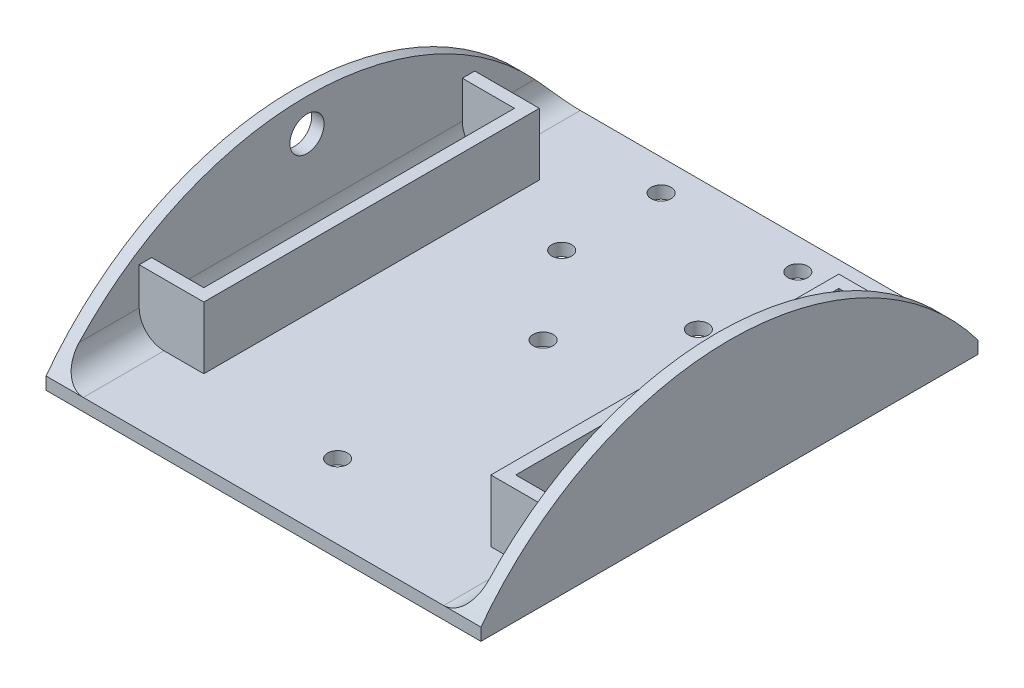
from build123d import *

# Parameters (mm, degrees)
SKETCH1_W           = 88.9
SKETCH1_H           = 101.6
BASE_EXTRUDE_DEPTH  = 2.54
WALL_EXTRUDE_DEPTH  = 2.54
CUT_EXTRUDE1_REACH  = 139.864
SKETCH3_R           = 3.4925
FILLET2_R           = 5.08
SKETCH4_R           = 2.032
CUT_EXTRUDE2_DEPTH  = 138.371503752
SKETCH5_W           = 2.54
SKETCH5_H           = 2.54
SKETCH5_W_2         = 5.08
SKETCH5_W_3         = 3.048
BOSS_EXTRUDE1_DEPTH = 12.7


with BuildPart() as part:
    # Sketch1 → Base Extrude (new body)
    with BuildSketch(Plane(origin=(0, 0, 0), x_dir=(1, 0, 0), z_dir=(0, 1, 0))):
        with Locations((44.45, 50.8)):
            Rectangle(SKETCH1_W, SKETCH1_H)
    extrude(amount=BASE_EXTRUDE_DEPTH)

    # Sketch2 → Wall Extrude (add)
    with BuildSketch(Plane(origin=(88.9, 0, 0), x_dir=(0, 0, -1), z_dir=(1, 0, 0))):
        with BuildLine():
            Line((101.6, 2.54), (101.6, 0))
            Line((101.6, 0), (0, 0))
            Line((0, 0), (0, 2.54))
            ThreePointArc((0, 2.54), (50.8, 27.94), (101.6, 2.54))
        make_face()
    wall_extrude = extrude(amount=-WALL_EXTRUDE_DEPTH)

    # Wall Mirror: Wall Extrude across plane
    add(wall_extrude.mirror(Plane(origin=(44.45, 0, 0), x_dir=(0, 0, 1), z_dir=(1, 0, 0))))

    # Sketch3 → Cut-Extrude1 (cut, up to next)
    with BuildSketch(Plane.ZY, mode=Mode.PRIVATE) as cut_extrude1_sk1:
        with Locations((-50.8, 21.2725)):
            Circle(SKETCH3_R)
    cut_extrude1_tool1 = extrude(cut_extrude1_sk1.sketch, amount=-CUT_EXTRUDE1_REACH, mode=Mode.PRIVATE) & part.part
    add(cut_extrude1_tool1.solids().sort_by_distance((0, 21.2725, -50.8))[0], mode=Mode.SUBTRACT)

    # Fillet2
    # the kernel refuses this fillet: 5.08 mm, written as the material it adds along each edge
    with BuildSketch(Plane(origin=(86.36, 2.54, -101.6), x_dir=(-1, 0, 0), z_dir=(0, 0, 1))) as fillet2_piece_1_section:
        with BuildLine():
            CenterArc((FILLET2_R, -FILLET2_R), FILLET2_R, 90, 90)
            Line((0, -FILLET2_R), (0, 0))
            Line((0, 0), (FILLET2_R, 0))
        make_face()
    fillet2_piece_1 = extrude(amount=101.6, mode=Mode.PRIVATE)
    fillet2_piece_1 = fillet2_piece_1 & Plane(origin=(85.198656014, -35.56, -50.8), x_dir=(0, 0.6000000000000003, 0.7999999999999998), z_dir=(1, 0, 0)) * Cylinder(63.5, 224, mode=Mode.PRIVATE)
    add(fillet2_piece_1)
    with BuildSketch(Plane(origin=(2.54, 2.54, -101.6), x_dir=(1, 0, 0), z_dir=(0, 0, 1))) as fillet2_piece_2_section:
        with BuildLine():
            CenterArc((FILLET2_R, FILLET2_R), FILLET2_R, 180, 90)
            Line((0, FILLET2_R), (0, 0))
            Line((0, 0), (FILLET2_R, 0))
        make_face()
    fillet2_piece_2 = extrude(amount=101.6, mode=Mode.PRIVATE)
    fillet2_piece_2 = fillet2_piece_2 & Plane(origin=(3.701343986, -35.56, -50.8), x_dir=(0, 0.6000000000000003, 0.7999999999999998), z_dir=(-1, 0, 0)) * Cylinder(63.5, 224, mode=Mode.PRIVATE)
    add(fillet2_piece_2)

    # Sketch4 → Cut-Extrude2 (cut, through all)
    with BuildSketch(Plane(origin=(0, 2.54, 0), x_dir=(1, 0, 0), z_dir=(0, 1, 0))):
        with Locations(Location((44.45, 57.15, 0), (0, 0, 270))):
            Circle(SKETCH4_R)
        with Locations(Location((44.45, 15.15, 0), (0, 0, 270))):
            Circle(SKETCH4_R)
        with Locations(Location((58.42, 74.93, 0), (0, 0, 270))):
            Circle(SKETCH4_R)
        with Locations(Location((58.42, 95.25, 0), (0, 0, 270))):
            Circle(SKETCH4_R)
        with Locations(Location((30.48, 74.93, 0), (0, 0, 90))):
            Circle(SKETCH4_R)
        with Locations(Location((30.48, 95.25, 0), (0, 0, 90))):
            Circle(SKETCH4_R)
    extrude(amount=-CUT_EXTRUDE2_DEPTH, mode=Mode.SUBTRACT)

    # Sketch5 → Boss-Extrude1 (add)
    with BuildSketch(Plane(origin=(0, 2.54, 0), x_dir=(1, 0, 0), z_dir=(0, 1, 0))):
        with Locations((87.63, 50.8)):
            Rectangle(SKETCH5_W, SKETCH5_H)
        Polygon((13.208, 82.55), (13.208, 19.05), (7.62, 19.05), (7.62, 16.51), (15.748, 16.51), (15.748, 85.09), (7.62, 85.09), (7.62, 82.55), align=None)
        with Locations((5.08, 17.78)):
            Rectangle(SKETCH5_W_2, SKETCH5_H)
        with Locations((5.08, 83.82)):
            Rectangle(SKETCH5_W_2, SKETCH5_H)
        Polygon((81.28, 83.82), (81.28, 86.36), (75.692, 86.36), (75.692, 52.07), (78.232, 52.07), (78.232, 83.82), align=None)
        Polygon((78.232, 49.53), (75.692, 49.53), (75.692, 15.24), (81.28, 15.24), (81.28, 17.78), (78.232, 17.78), align=None)
        with Locations((83.82, 50.8)):
            Rectangle(SKETCH5_W_2, SKETCH5_H)
        with Locations((79.756, 50.8)):
            Rectangle(SKETCH5_W_3, SKETCH5_H)
        with Locations((76.962, 50.8)):
            Rectangle(SKETCH5_W, SKETCH5_H)
        with Locations((83.82, 85.09)):
            Rectangle(SKETCH5_W_2, SKETCH5_H)
        with Locations((83.82, 16.51)):
            Rectangle(SKETCH5_W_2, SKETCH5_H)
    extrude(amount=BOSS_EXTRUDE1_DEPTH)


solid = part.part
